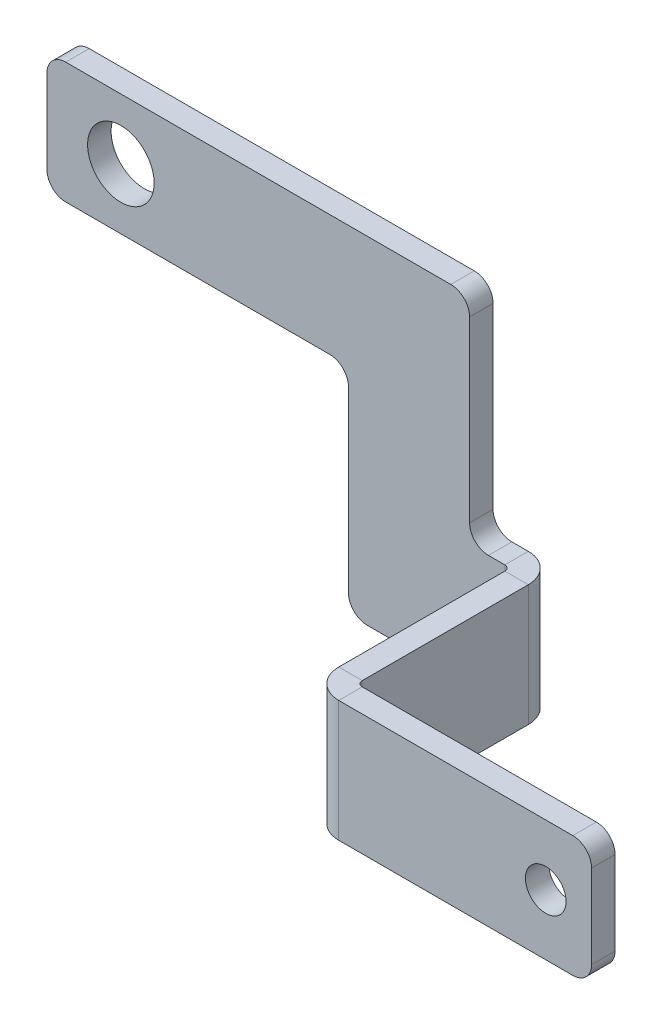
from build123d import *

# Parameters (mm, degrees)
BASE_FLANGE1_DEPTH           = 3.175
M8_CLEARANCE_HOLE1_D         = 9
EDGE_FLANGE1_DEPTH           = 16.378
EDGE_FLANGE2_STRIP_W         = 14.1732
EDGE_FLANGE2_STRIP_H         = 3.175
EDGE_FLANGE2_STRIP_CUT_DEPTH = 16.378
EDGE_FLANGE2_DEPTH           = 16.378
M5_CLEARANCE_HOLE1_D         = 5.5
FILLET1_R                    = 2.54


# Sheet-metal steps are written as plain solids
with BuildPart() as part:
    # Sketch1 → Base-Flange1 (new body)
    with BuildSketch(Plane.XY):
        Polygon((0, 0), (57.15, 0), (57.15, -16.378), (57.15, -29.184600001), (61.9125, -29.184600001), (61.9125, -45.562600001), (57.15, -45.562600001), (40.772, -45.562600001), (40.772, -16.378), (0, -16.378), align=None)
    extrude(amount=-BASE_FLANGE1_DEPTH)

    # M8 Clearance Hole1 (through all)
    with Locations(Plane.XY):
        with Locations((10, -8.189)):
            Hole(M8_CLEARANCE_HOLE1_D / 2)

    # Edge-Flange1 section (across the edge) → Edge-Flange1 (add)
    with BuildSketch(Plane(origin=(62.6491, -45.562600001, 0), x_dir=(-1, 0, 0), z_dir=(0, 1, 0))):
        with BuildLine():
            Line((-3.175, 0.7366), (-3.175, 23.9268))
            Line((-3.175, 23.9268), (0, 23.9268))
            Line((0, 23.9268), (0, 0.7366))
            ThreePointArc((0, 0.7366), (0.215745145, 0.215745145), (0.7366, 0))
            Line((0.7366, 0), (0.7366, -3.175))
            ThreePointArc((0.7366, -3.175), (-2.029318885, -2.029318885), (-3.175, 0.7366))
        make_face()
    extrude(amount=EDGE_FLANGE1_DEPTH)

    # Edge-Flange2 strip (across the edge) → Edge-Flange2 strip cut (cut)
    with BuildSketch(Plane(origin=(65.8241, -29.184600001, 23.9268), x_dir=(0, 0, -1), z_dir=(0, -1, 0))):
        with Locations((-6.35, -1.5875)):
            Rectangle(EDGE_FLANGE2_STRIP_W, EDGE_FLANGE2_STRIP_H)
    extrude(amount=EDGE_FLANGE2_STRIP_CUT_DEPTH, mode=Mode.SUBTRACT)

    # Edge-Flange2 section (across the edge) → Edge-Flange2 (add)
    with BuildSketch(Plane(origin=(65.8241, -29.184600001, 23.9268), x_dir=(0, 0, -1), z_dir=(0, -1, 0))):
        with BuildLine():
            Line((-3.175, 0.7366), (-3.175, 34.925))
            Line((-3.175, 34.925), (0, 34.925))
            Line((0, 34.925), (0, 0.7366))
            ThreePointArc((0, 0.7366), (0.215745145, 0.215745145), (0.7366, 0))
            Line((0.7366, 0), (0.7366, -3.175))
            ThreePointArc((0.7366, -3.175), (-2.029318885, -2.029318885), (-3.175, 0.7366))
        make_face()
    extrude(amount=EDGE_FLANGE2_DEPTH)

    # M5 Clearance Hole1 (through all)
    with Locations(Plane.XY.offset(27.1018)):
        with Locations((94.5499, -37.373600001)):
            Hole(M5_CLEARANCE_HOLE1_D / 2)

    # Fillet1
    fillet1_edges = [part.edges().sort_by_distance(p)[0] for p in [
        (0, 0, -1.5875),
        (57.15, 0, -1.5875),
        (57.15, -29.184600001, -1.5875),
        (40.772, -45.562600001, -1.5875),
        (40.772, -16.378, -1.5875),
        (0, -16.378, -1.5875),
        (100.7491, -29.184600001, 25.5143),
        (100.7491, -45.562600001, 25.5143),
    ]]
    fillet(fillet1_edges, radius=FILLET1_R)


solid = part.part
